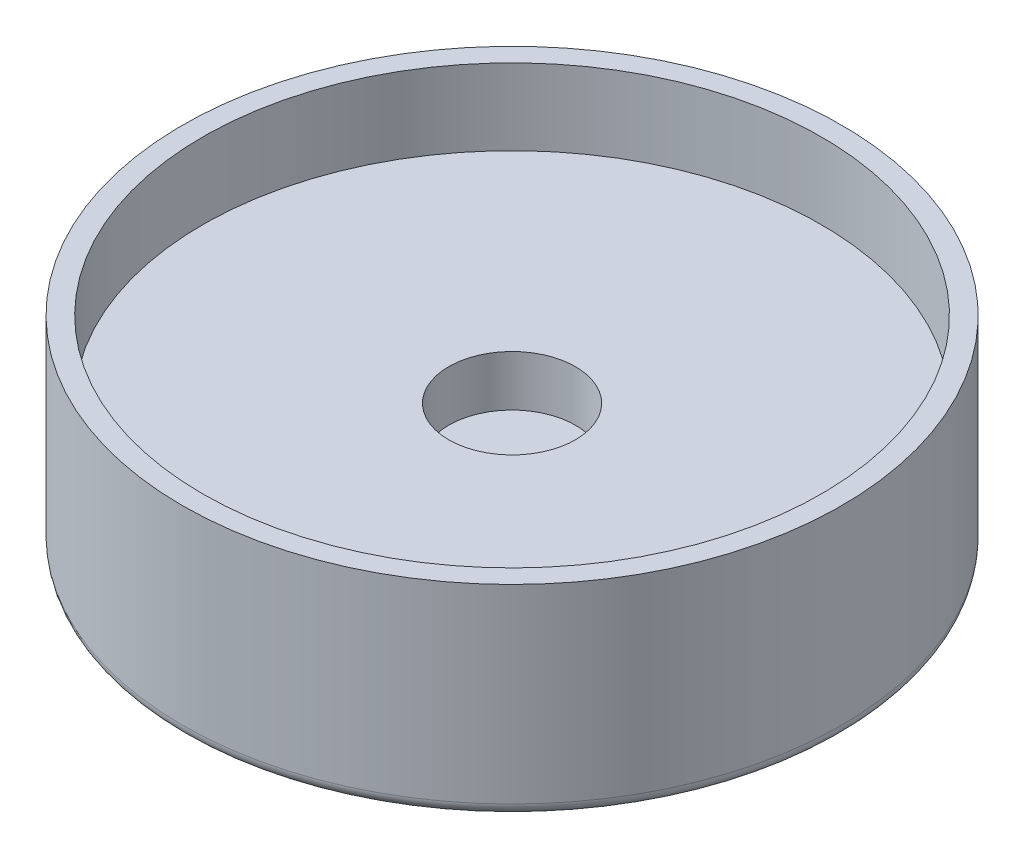
from build123d import *

# Parameters (mm, degrees)
SKETCH_1_R          = 13
EXTRUDE_1_DEPTH     = 8
SKETCH_2_R          = 12
CUT_EXTRUDE_1_DEPTH = 3
SKETCH_3_R          = 2.5
CUT_EXTRUDE_2_DEPTH = 2
FILLET_1_R          = 0.5
SKETCH_4_R          = 12.2
CUT_EXTRUDE_3_DEPTH = 20.052558883


with BuildPart() as part:
    # 草图1 → 凸台-拉伸1 (new body)
    with BuildSketch(Plane(origin=(0, 0, 0), x_dir=(1, 0, 0), z_dir=(0, 1, 0))):
        Circle(SKETCH_1_R)
    extrude(amount=EXTRUDE_1_DEPTH)

    # 草图2 → 切除-拉伸1 (cut)
    with BuildSketch(Plane(origin=(0, 8, 0), x_dir=(1, 0, 0), z_dir=(0, 1, 0))):
        Circle(SKETCH_2_R)
    extrude(amount=-CUT_EXTRUDE_1_DEPTH, mode=Mode.SUBTRACT)

    # 草图3 → 切除-拉伸2 (cut)
    with BuildSketch(Plane(origin=(0, 5, 0), x_dir=(1, 0, 0), z_dir=(0, 1, 0))):
        Circle(SKETCH_3_R)
    extrude(amount=-CUT_EXTRUDE_2_DEPTH, mode=Mode.SUBTRACT)

    # 圆角1
    fillet_1_edges = [part.edges().sort_by_distance(p)[0] for p in [
        (-13, 0, 0),
    ]]
    fillet(fillet_1_edges, radius=FILLET_1_R)

    # 草图4 → 切除-拉伸3 (cut, through all)
    with BuildSketch(Plane(origin=(0, 5, 0), x_dir=(1, 0, 0), z_dir=(0, 1, 0))):
        Circle(SKETCH_4_R)
    extrude(amount=CUT_EXTRUDE_3_DEPTH, mode=Mode.SUBTRACT)


solid = part.part
